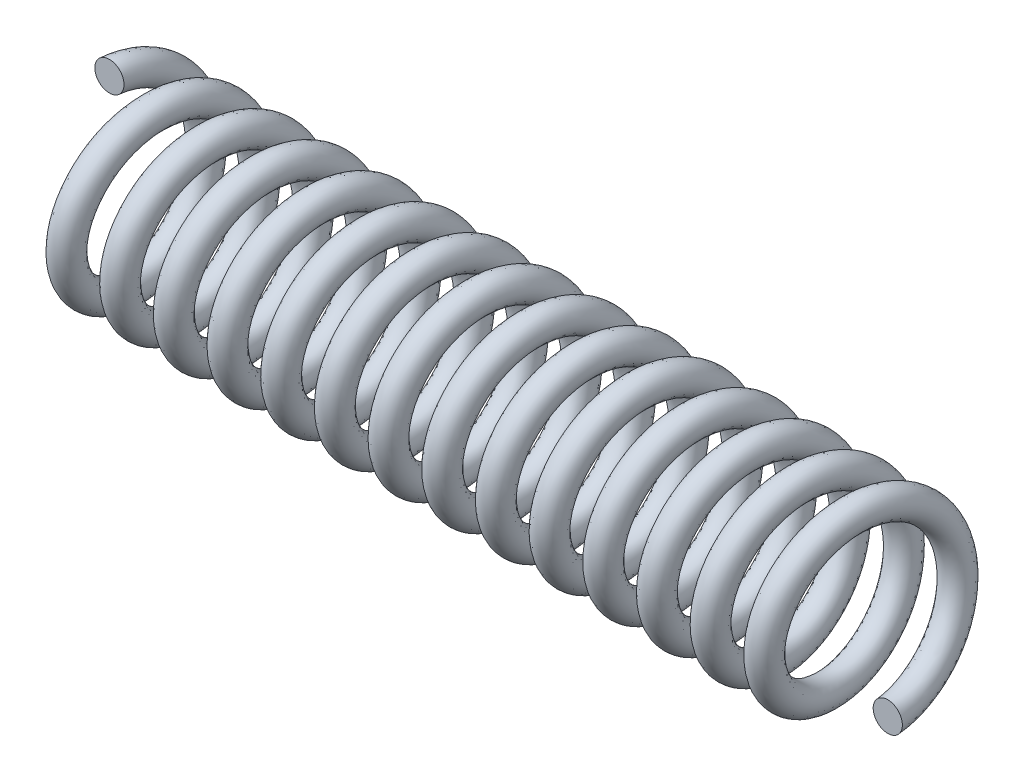
from build123d import *

# Parameters (mm, degrees)
SWEEP_1_PITCH       = 1.379310345
SWEEP_1_HEIGHT      = 20
SWEEP_1_RADIUS      = 2.125
SWEEP_1_START_ANGLE = -90
SKETCH_3_R          = 0.375


with BuildPart() as part:
    # По траектории1: sweep along a helix
    with BuildLine() as sweep_1_path:
        add(Helix(SWEEP_1_PITCH, SWEEP_1_HEIGHT, SWEEP_1_RADIUS, center=(0, 0, 0), direction=(1, 0, 0), lefthand=True, mode=Mode.PRIVATE).rotate(Axis((0, 0, 0), (1, 0, 0)), SWEEP_1_START_ANGLE))
    # Эскиз3 → По траектории1 (sweep)
    with BuildSketch(Plane.XY):
        with Locations((0, 2.125)):
            Circle(SKETCH_3_R)
    sweep(path=sweep_1_path.line, is_frenet=True)


solid = part.part
